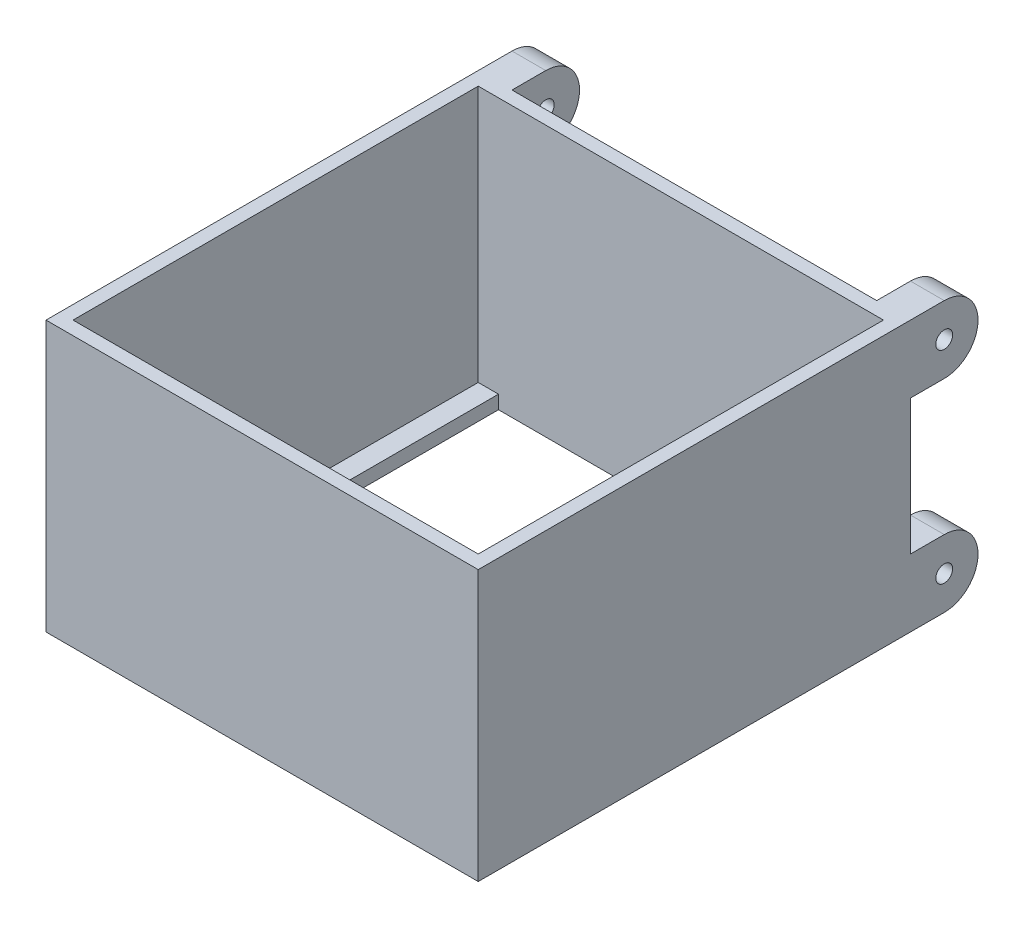
from build123d import *

# Parameters (mm, degrees)
SKETCH1_W           = 81.28
SKETCH1_H           = 81.28
SKETCH1_W_2         = 76.2
SKETCH1_H_2         = 76.2
BOSS_EXTRUDE1_DEPTH = 50.8
SKETCH2_W           = 3.81
SKETCH2_H           = 76.2
BOSS_EXTRUDE2_DEPTH = 2.54
SKETCH3_R           = 1.5748
BOSS_EXTRUDE3_DEPTH = 6.35
SKETCH4_R           = 1.5875
BOSS_EXTRUDE4_DEPTH = 6.35


with BuildPart() as part:
    # Sketch1 → Boss-Extrude1 (new body)
    with BuildSketch(Plane(origin=(0, 0, 0), x_dir=(1, 0, 0), z_dir=(0, 1, 0))):
        Rectangle(SKETCH1_W, SKETCH1_H)
        Rectangle(SKETCH1_W_2, SKETCH1_H_2, mode=Mode.SUBTRACT)
    extrude(amount=BOSS_EXTRUDE1_DEPTH)

    # Sketch2 → Boss-Extrude2 (add)
    with BuildSketch(Plane(origin=(0, 0, 0), x_dir=(1, 0, 0), z_dir=(0, 1, 0))):
        with Locations((-36.195, 0)):
            Rectangle(SKETCH2_W, SKETCH2_H)
        with Locations((36.195, 0)):
            Rectangle(SKETCH2_W, SKETCH2_H)
    extrude(amount=BOSS_EXTRUDE2_DEPTH)

    # Sketch3 → Boss-Extrude3 (add)
    with BuildSketch(Plane(origin=(40.64, 0, 0), x_dir=(0, 0, -1), z_dir=(1, 0, 0))):
        with BuildLine():
            Line((46.99, 12.7), (40.64, 12.7))
            Line((40.64, 12.7), (40.64, 0))
            Line((40.64, 0), (46.99, 0))
            ThreePointArc((46.99, 0), (53.34, 6.35), (46.99, 12.7))
        make_face()
        with Locations((46.99, 6.35)):
            Circle(SKETCH3_R, mode=Mode.SUBTRACT)
    boss_extrude3 = extrude(amount=-BOSS_EXTRUDE3_DEPTH)

    # Sketch4 → Boss-Extrude4 (add)
    with BuildSketch(Plane(origin=(40.64, 0, 0), x_dir=(0, 0, -1), z_dir=(1, 0, 0))):
        with BuildLine():
            Line((46.99, 50.8), (40.64, 50.8))
            Line((40.64, 50.8), (40.64, 38.1))
            Line((40.64, 38.1), (46.99, 38.1))
            ThreePointArc((46.99, 38.1), (53.34, 44.45), (46.99, 50.8))
        make_face()
        with Locations((46.99, 44.45)):
            Circle(SKETCH4_R, mode=Mode.SUBTRACT)
    boss_extrude4 = extrude(amount=-BOSS_EXTRUDE4_DEPTH)

    # Mirror1: Boss-Extrude3, Boss-Extrude4 across plane
    add(boss_extrude3.mirror(Plane.ZY))
    add(boss_extrude4.mirror(Plane.ZY))


solid = part.part
